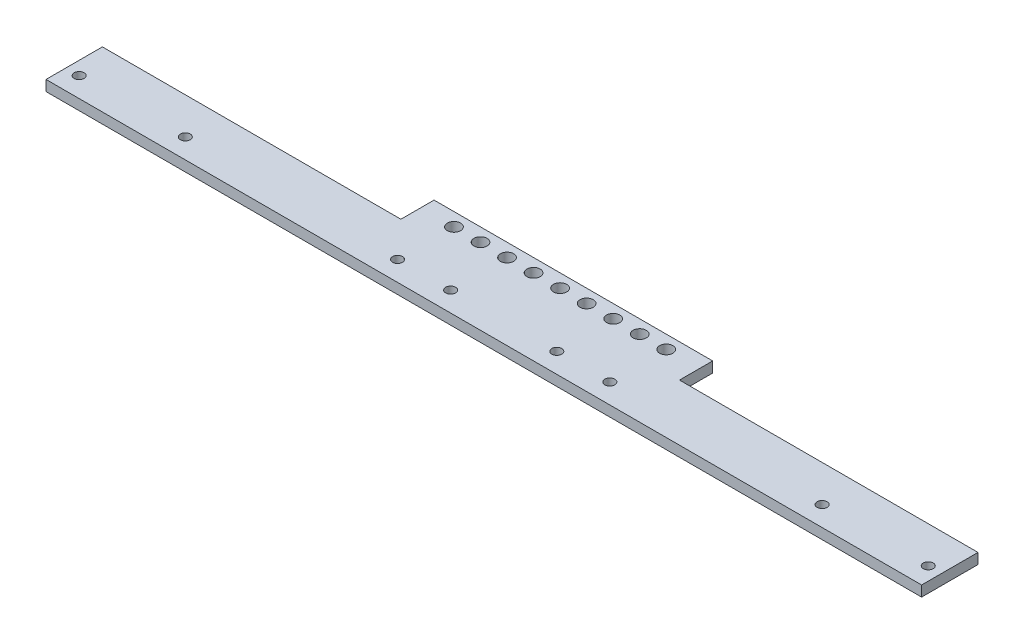
from build123d import *

# Parameters (mm, degrees)
SKETCH1_R           = 2
SKETCH1_R_2         = 1.5
BOSS_EXTRUDE1_DEPTH = 3.175
SKETCH2_R           = 1.5
CUT_EXTRUDE1_DEPTH  = 10
SKETCH3_W           = 90
SKETCH3_H           = 10
CUT_EXTRUDE2_DEPTH  = 10
CUT_EXTRUDE3_START  = -10
SKETCH4_R           = 2
CUT_EXTRUDE3_DEPTH  = 10


with BuildPart() as part:
    # Sketch1 → Boss-Extrude1 (new body)
    with BuildSketch(Plane(origin=(0, 0, 0), x_dir=(1, 0, 0), z_dir=(0, 1, 0))):
        Polygon((0, 25.535634143), (0, -1.464365857), (264, -1.464365857), (264, 4.535634143), (264, 25.535634143), align=None)
        with Locations((132, 21.535634143)):
            Circle(SKETCH1_R, mode=Mode.SUBTRACT)
        with Locations((100, 21.535634143)):
            Circle(SKETCH1_R, mode=Mode.SUBTRACT)
        with Locations((68, 21.535634143)):
            Circle(SKETCH1_R, mode=Mode.SUBTRACT)
        with Locations((196, 21.535634143)):
            Circle(SKETCH1_R, mode=Mode.SUBTRACT)
        with Locations((164, 21.535634143)):
            Circle(SKETCH1_R, mode=Mode.SUBTRACT)
        with Locations((260, 4.535634143)):
            Circle(SKETCH1_R_2, mode=Mode.SUBTRACT)
        with Locations((36, 4.535634143)):
            Circle(SKETCH1_R_2, mode=Mode.SUBTRACT)
        with Locations((228, 4.535634143)):
            Circle(SKETCH1_R_2, mode=Mode.SUBTRACT)
        with Locations((4, 4.535634143)):
            Circle(SKETCH1_R_2, mode=Mode.SUBTRACT)
    extrude(amount=BOSS_EXTRUDE1_DEPTH)

    # Sketch2 → Cut-Extrude1 (cut)
    with BuildSketch(Plane(origin=(0, 3.175, 0), x_dir=(1, 0, 0), z_dir=(0, 1, 0))):
        with Locations((116, 4.535634143)):
            Circle(SKETCH2_R)
        with Locations((148, 4.535634143)):
            Circle(SKETCH2_R)
        with Locations((100, 4.535634143)):
            Circle(SKETCH2_R)
        with Locations((164, 4.535634143)):
            Circle(SKETCH2_R)
    extrude(amount=-CUT_EXTRUDE1_DEPTH, mode=Mode.SUBTRACT)

    # Sketch3 → Cut-Extrude2 (cut)
    with BuildSketch(Plane(origin=(0, 3.175, 0), x_dir=(1, 0, 0), z_dir=(0, 1, 0))):
        with Locations((45, 20.535634143)):
            Rectangle(SKETCH3_W, SKETCH3_H)
        with Locations((219, 20.535634143)):
            Rectangle(SKETCH3_W, SKETCH3_H)
    extrude(amount=-CUT_EXTRUDE2_DEPTH, mode=Mode.SUBTRACT)

    # Sketch4 → Cut-Extrude3 (cut)
    with BuildSketch(Plane(origin=(0, 3.175, 0), x_dir=(1, 0, 0), z_dir=(0, 1, 0)).offset(CUT_EXTRUDE3_START)):
        with Locations((100, 21.535634143)):
            Circle(SKETCH4_R)
        with Locations((108, 21.535634143)):
            Circle(SKETCH4_R)
        with Locations((116, 21.535634143)):
            Circle(SKETCH4_R)
        with Locations((124, 21.535634143)):
            Circle(SKETCH4_R)
        with Locations((132, 21.535634143)):
            Circle(SKETCH4_R)
        with Locations((140, 21.535634143)):
            Circle(SKETCH4_R)
        with Locations((148, 21.535634143)):
            Circle(SKETCH4_R)
        with Locations((156, 21.535634143)):
            Circle(SKETCH4_R)
        with Locations((164, 21.535634143)):
            Circle(SKETCH4_R)
    extrude(amount=CUT_EXTRUDE3_DEPTH, mode=Mode.SUBTRACT)


solid = part.part
